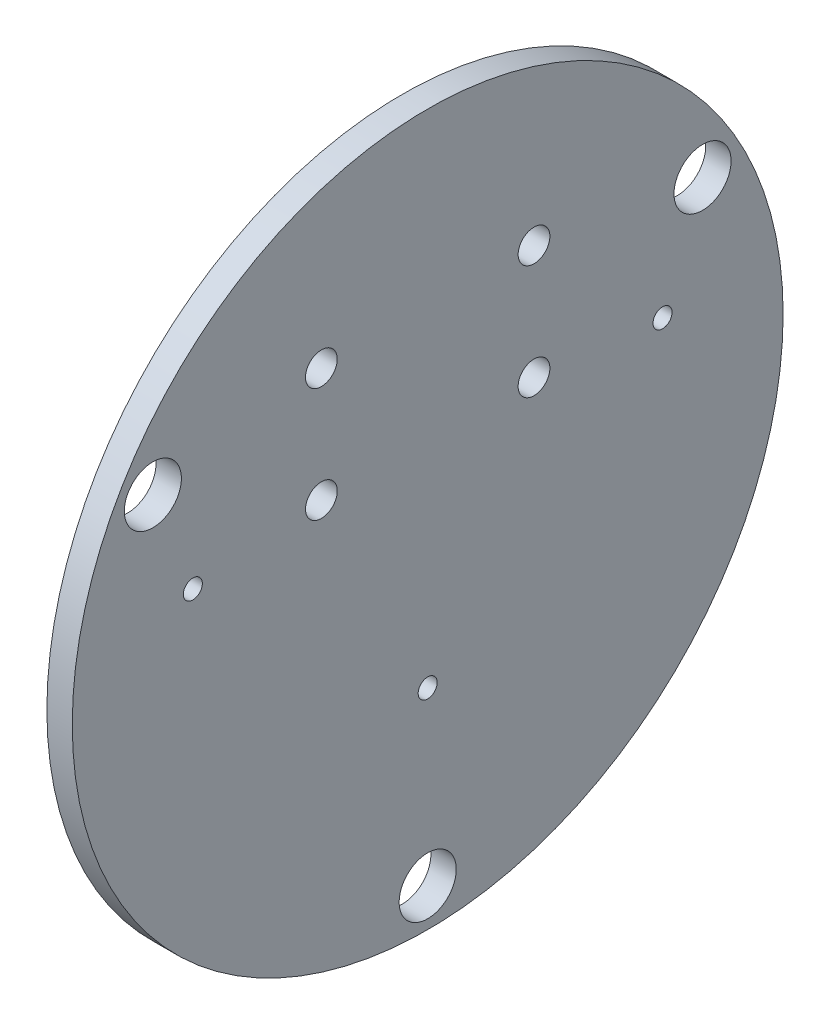
from build123d import *

# Parameters (mm, degrees)
SKETCH1_R           = 56
BOSS_EXTRUDE1_DEPTH = 4
SKETCH2_R           = 4.5
CUT_EXTRUDE1_DEPTH  = 80.296910406
SKETCH4_R           = 2.5
SKETCH4_R_2         = 1.5
CUT_EXTRUDE3_DEPTH  = 80.296910406


with BuildPart() as part:
    # Sketch1 → Boss-Extrude1 (new body)
    with BuildSketch(Plane(origin=(0, 0, 0), x_dir=(0, 0, -1), z_dir=(1, 0, 0))):
        Circle(SKETCH1_R)
    extrude(amount=BOSS_EXTRUDE1_DEPTH)

    # Sketch2 → Cut-Extrude1 (cut, through all)
    with BuildSketch(Plane.ZY):
        with Locations((-43.301270189, 25)):
            Circle(SKETCH2_R)
        with Locations((43.301270189, 25)):
            Circle(SKETCH2_R)
        with Locations((0, -50)):
            Circle(SKETCH2_R)
    extrude(amount=-CUT_EXTRUDE1_DEPTH, mode=Mode.SUBTRACT)

    # Sketch4 → Cut-Extrude3 (cut, through all)
    with BuildSketch(Plane(origin=(4, 0, 0), x_dir=(0, 0, -1), z_dir=(1, 0, 0))):
        with Locations((-16.75, 28.995494219)):
            Circle(SKETCH4_R)
        with Locations((16.75, 28.995494219)):
            Circle(SKETCH4_R)
        with Locations((16.75, 11)):
            Circle(SKETCH4_R)
        with Locations((-16.75, 11)):
            Circle(SKETCH4_R)
        with Locations((-37, 9)):
            Circle(SKETCH4_R_2)
        with Locations((0, -23)):
            Circle(SKETCH4_R_2)
        with Locations((37, 9)):
            Circle(SKETCH4_R_2)
    extrude(amount=-CUT_EXTRUDE3_DEPTH, mode=Mode.SUBTRACT)


solid = part.part
